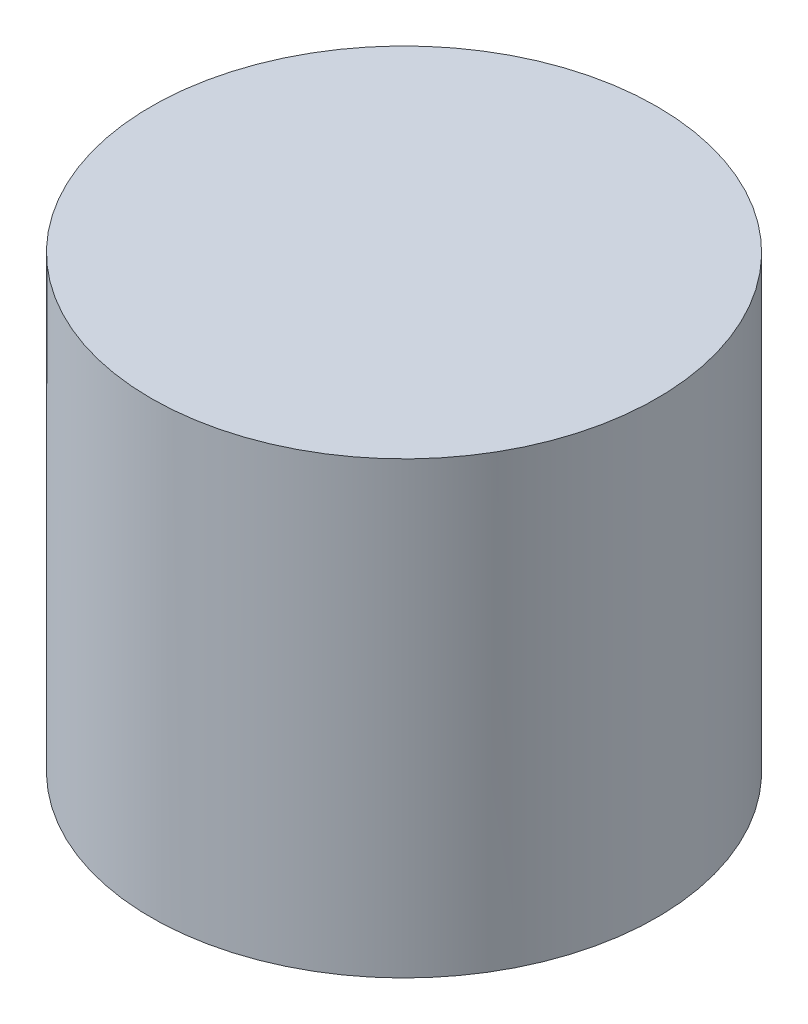
from build123d import *

# Parameters (mm, degrees)
SKETCH1_R           = 22.5
BOSS_EXTRUDE1_DEPTH = 3
BOSS_EXTRUDE2_START = 37
SKETCH2_R           = 22.5
SKETCH2_R_2         = 18
BOSS_EXTRUDE2_DEPTH = 37
FILLET1_R           = 5
BOSS_EXTRUDE3_START = -6
SKETCH3_R           = 18
SKETCH3_R_2         = 17.100000000000033
BOSS_EXTRUDE3_DEPTH = 6


with BuildPart() as part:
    # Sketch1 → Boss-Extrude1 (new body)
    with BuildSketch(Plane(origin=(0, 0, 0), x_dir=(1, 0, 0), z_dir=(0, 1, 0))):
        with Locations(Location((0, 0, 0), (0, 0, 270))):
            Circle(SKETCH1_R)
    extrude(amount=BOSS_EXTRUDE1_DEPTH)

    # Sketch2 → Boss-Extrude2 (add)
    with BuildSketch(Plane(origin=(0, 0, 0), x_dir=(-1, 0, 0), z_dir=(0, -1, 0)).offset(BOSS_EXTRUDE2_START)):
        with Locations(Location((0, 0, 0), (0, 0, 90))):
            Circle(SKETCH2_R)
        with Locations(Location((0, 0, 0), (0, 0, 90))):
            Circle(SKETCH2_R_2, mode=Mode.SUBTRACT)
    extrude(amount=-BOSS_EXTRUDE2_DEPTH)

    # Fillet1
    # the kernel refuses this fillet: 5 mm, written as the material it takes off along each edge
    with BuildSketch(Plane(origin=(0, -37, 0), x_dir=(-6e-17, 0, -1), z_dir=(-1, 0, 6e-17))) as fillet1_piece_1:
        with BuildLine():
            CenterArc((23, -4.974937185533101), FILLET1_R, 95.73917047726678, 84.26082952273322)
            Line((18, -4.974937185533101), (17.9, -4.974937185533101))
            Line((17.9, -4.974937185533101), (17.9, 0))
            Line((17.9, 0), (18, 0.10000000000000142))
            ThreePointArc((18, 0.10000000000000142), (20.25, 0.10000000000000142), (22.49, 0.09949874371066159))
            Line((22.49, 0.09949874371066159), (22.5, 0))
        make_face()
    revolve(axis=Axis((0, -37, 0), (0, -1, 0)), mode=Mode.SUBTRACT)

    # Sketch3 → Boss-Extrude3 (add)
    with BuildSketch(Plane(origin=(0, 3, 0), x_dir=(1, 0, 0), z_dir=(0, 1, 0)).offset(BOSS_EXTRUDE3_START)):
        with Locations(Location((0, 0, 0), (0, 0, 270))):
            Circle(SKETCH3_R)
        with Locations(Location((0, 0, 0), (0, 0, 270))):
            Circle(SKETCH3_R_2, mode=Mode.SUBTRACT)
    extrude(amount=BOSS_EXTRUDE3_DEPTH)


solid = part.part
